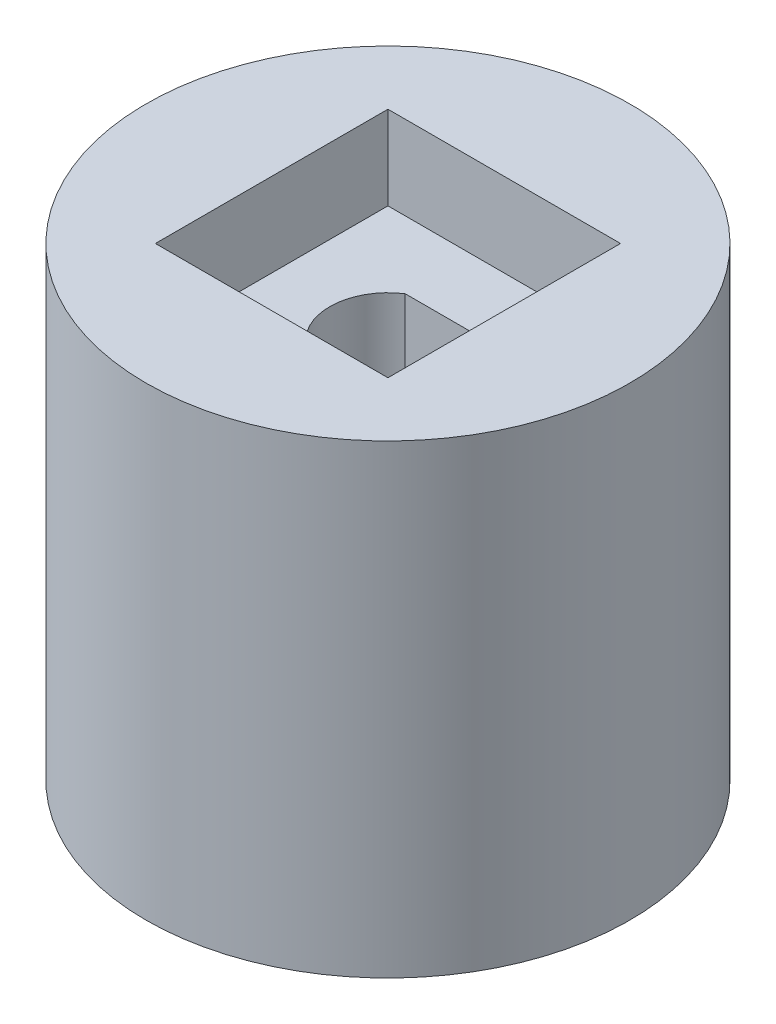
from build123d import *

# Parameters (mm, degrees)
SKETCH1_R           = 13.208
BOSS_EXTRUDE4_DEPTH = 25.4
CUT_EXTRUDE3_DEPTH  = 32.528757159
CUT_EXTRUDE4_DEPTH  = 4.064
SKETCH2_W           = 12.7
SKETCH2_H           = 12.7
CUT_EXTRUDE5_DEPTH  = 4.572


with BuildPart() as part:
    # Sketch1 → Boss-Extrude4 (new body)
    with BuildSketch(Plane(origin=(0, 0, 0), x_dir=(1, 0, 0), z_dir=(0, 1, 0))):
        Circle(SKETCH1_R)
    extrude(amount=BOSS_EXTRUDE4_DEPTH)

    # Sketch1<6> → Cut-Extrude3 (cut, through all)
    with BuildSketch(Plane(origin=(0, 0, 0), x_dir=(1, 0, 0), z_dir=(0, 1, 0))):
        with BuildLine():
            Line((1.722711816, 2.667), (0, 2.667))
            Line((0, 2.667), (-1.722711816, 2.667))
            ThreePointArc((-1.722711816, 2.667), (-1.51838977, -2.78838977), (3.175, 0))
            ThreePointArc((3.175, 0), (2.78838977, 1.51838977), (1.722711816, 2.667))
        make_face()
    extrude(amount=CUT_EXTRUDE3_DEPTH, mode=Mode.SUBTRACT)

    # Sketch1<7> → Cut-Extrude4 (cut)
    with BuildSketch(Plane(origin=(0, 0, 0), x_dir=(1, 0, 0), z_dir=(0, 1, 0))):
        with BuildLine():
            Line((-1.722711816, 2.667), (0, 2.667))
            Line((0, 2.667), (1.722711816, 2.667))
            ThreePointArc((1.722711816, 2.667), (0, 3.175), (-1.722711816, 2.667))
        make_face()
    extrude(amount=CUT_EXTRUDE4_DEPTH, mode=Mode.SUBTRACT)

    # Sketch2 → Cut-Extrude5 (cut)
    with BuildSketch(Plane(origin=(0, 25.4, 0), x_dir=(1, 0, 0), z_dir=(0, 1, 0))):
        Rectangle(SKETCH2_W, SKETCH2_H)
    extrude(amount=-CUT_EXTRUDE5_DEPTH, mode=Mode.SUBTRACT)


solid = part.part
